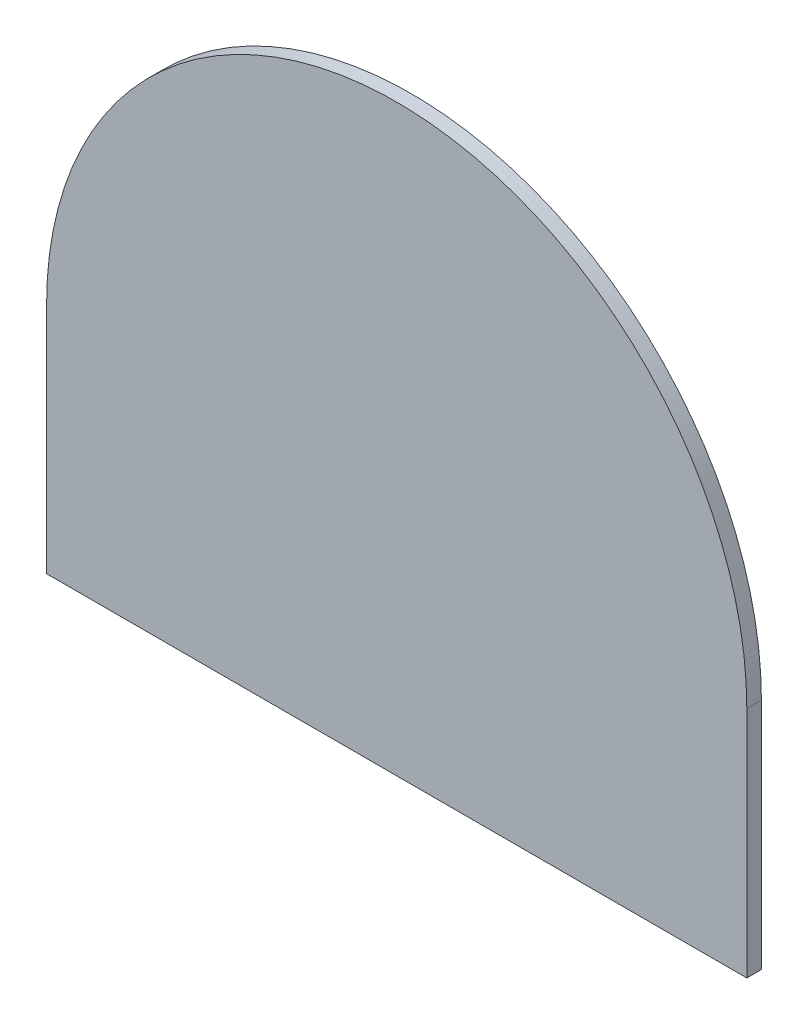
from build123d import *

# Parameters (mm, degrees)
BOSS_EXTRUDE1_DEPTH = 9.525


with BuildPart() as part:
    # Sketch1 → Boss-Extrude1 (new body)
    with BuildSketch(Plane.XY):
        with BuildLine():
            Line((-228.6, -36.83), (-228.6, -189.23))
            Line((-228.6, -189.23), (228.6, -189.23))
            Line((228.6, -189.23), (228.6, -36.83))
            ThreePointArc((228.6, -36.83), (0, 191.77), (-228.6, -36.83))
        make_face()
    extrude(amount=BOSS_EXTRUDE1_DEPTH)


solid = part.part
